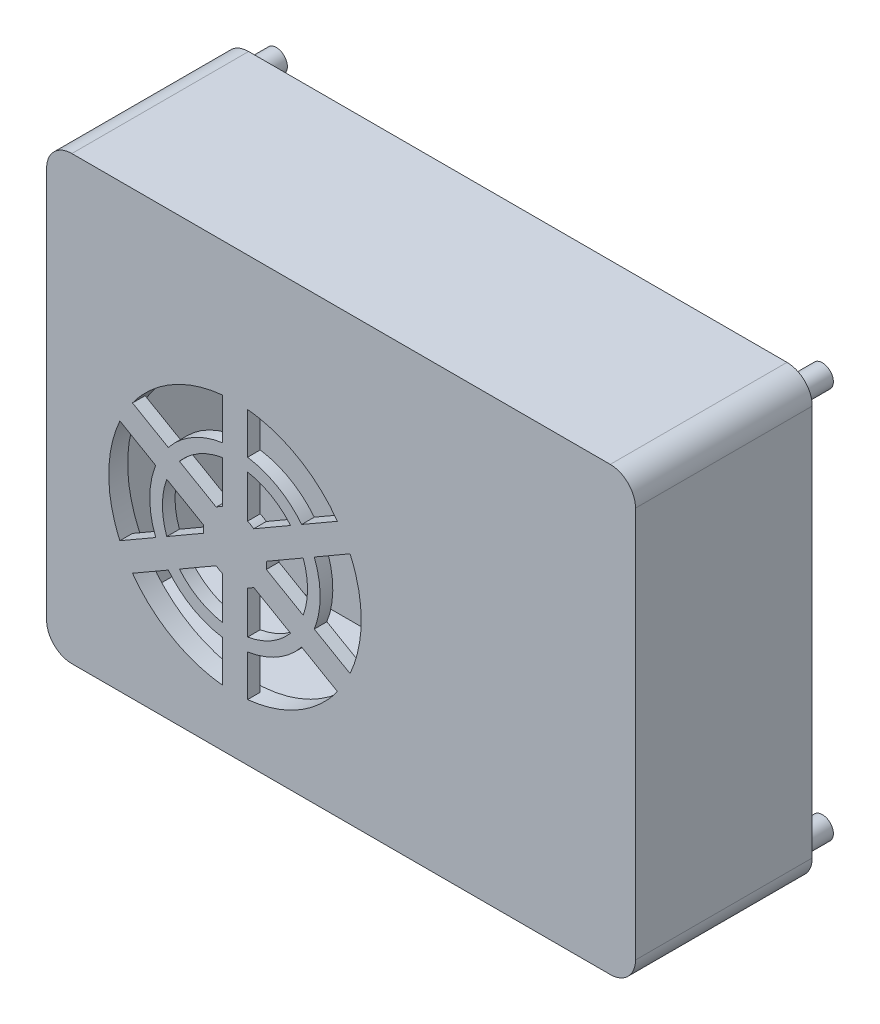
from build123d import *

# Parameters (mm, degrees)
BOSS_EXTRUDE1_DEPTH     = 28
SKETCH2_R               = 1.75
BOSS_EXTRUDE4_DEPTH     = 5
CUT_EXTRUDE_START       = 5
SKETCH_2_W              = 83.3
SKETCH_2_H              = 60
CUT_EXTRUDE_1_DEPTH     = 20
MACRO_START             = 25
MACRO_FEATURE_1_DEPTH   = 3
MACRO_FEATURE_1_2_DEPTH = 1


# Read off the part's stored shape, not the designer's step: 通风口1
with BuildPart() as part:
    # Sketch1 → Boss-Extrude1 (new body)
    with BuildSketch(Plane.XY):
        with BuildLine():
            Line((-42.65, -35), (42.65, -35))
            ThreePointArc((42.65, -35), (45.478427125, -33.828427125), (46.65, -31))
            Line((46.65, -31), (46.65, 31))
            ThreePointArc((46.65, 31), (45.478427125, 33.828427125), (42.65, 35))
            Line((42.65, 35), (-42.65, 35))
            ThreePointArc((-42.65, 35), (-45.478427125, 33.828427125), (-46.65, 31))
            Line((-46.65, 31), (-46.65, -31))
            ThreePointArc((-46.65, -31), (-45.478427125, -33.828427125), (-42.65, -35))
        make_face()
    extrude(amount=BOSS_EXTRUDE1_DEPTH)

    # Sketch2 → Boss-Extrude4 (add)
    with BuildSketch(Plane.XY):
        with Locations((-43.25, -31)):
            Circle(SKETCH2_R)
        with Locations((-43.25, 31)):
            Circle(SKETCH2_R)
        with Locations((43.25, -31)):
            Circle(SKETCH2_R)
        with Locations((43.25, 31)):
            Circle(SKETCH2_R)
    extrude(amount=-BOSS_EXTRUDE4_DEPTH)

    # 草图2 → 切除-拉伸1 (cut)
    with BuildSketch(Plane.XY.offset(CUT_EXTRUDE_START)):
        Rectangle(SKETCH_2_W, SKETCH_2_H)
    extrude(amount=CUT_EXTRUDE_1_DEPTH, mode=Mode.SUBTRACT)

    # Macro Feature 1 outline → Macro Feature 1 (cut)
    with BuildSketch(Plane.XY.offset(MACRO_START)):
        with BuildLine():
            add(Edge.make_bspline(
                [(1.426287217, -14.318481279), (1.51048252, -14.131697761), (2.111375863, -12.741996864), (2.934772067, -10.027623346), (3.321543695, -6.100665106), (2.934772067, -2.173706865), (2.111375766, 0.540666973), (1.510482256, 1.93036816), (1.426286806, 2.117151978)],
                knots=[0.932608761, 0.932608761, 0.932608761, 0.932608761, 0.9375, 0.96875, 1, 1.03125, 1.0625, 1.067391247, 1.067391247, 1.067391247, 1.067391247], degree=3))
            Line((1.426286806, 2.117151978), (-4.245054535, -1.157202769))
            add(Edge.make_bspline(
                [(-4.245054936, -11.044128462), (-3.950864394, -10.29643753), (-3.473540164, -8.671281329), (-3.307380181, -6.98423071), (-3.307380181, -6.100665106), (-3.307380181, -5.217099501), (-3.473540128, -3.530049248), (-3.950864187, -1.904893384), (-4.245054535, -1.157202769)],
                knots=[0.940332295, 0.940332295, 0.940332295, 0.940332295, 0.96875, 1, 1, 1, 1.03125, 1.059667692, 1.059667692, 1.059667692, 1.059667692], degree=3))
            Line((-4.245054936, -11.044128462), (1.426287217, -14.318481279))
        make_face()
        with BuildLine():
            Line((-6.245083648, 2.306863228), (-0.573711847, 5.581242019))
            add(Edge.make_bspline(
                [(-0.573711847, 5.581242019), (-1.203151971, 6.455827928), (-2.753859768, 8.280173587), (-5.624349253, 10.635923426), (-9.104374502, 12.496035675), (-12.238304555, 13.446702963), (-14.169380367, 13.734885584), (-14.807380181, 13.799005145)],
                knots=[0.099275483, 0.099275483, 0.099275483, 0.099275483, 0.125, 0.15625, 0.1875, 0.21875, 0.2340578, 0.2340578, 0.2340578, 0.2340578], degree=3))
            Line((-14.807380181, 13.799005145), (-14.807389315, 7.250337375))
            add(Edge.make_bspline(
                [(-6.245083648, 2.306863228), (-6.562071208, 2.705072273), (-7.49087461, 3.745605129), (-9.258834304, 5.196532153), (-11.607851348, 6.452107921), (-13.513275888, 7.030112136), (-14.595308244, 7.218580527), (-14.807389315, 7.250337375)],
                knots=[0.106998881, 0.106998881, 0.106998881, 0.106998881, 0.125, 0.15625, 0.1875, 0.21875, 0.226334474, 0.226334474, 0.226334474, 0.226334474], degree=3))
        make_face()
        with BuildLine():
            add(Edge.make_bspline(
                [(-14.807380181, -26.000335357), (-14.169380367, -25.936215795), (-12.238304555, -25.648033174), (-9.104374502, -24.697365886), (-5.624349253, -22.837253637), (-2.753860037, -20.481504018), (-1.20315242, -18.657158668), (-0.573712453, -17.782573072)],
                knots=[0.7659422, 0.7659422, 0.7659422, 0.7659422, 0.78125, 0.8125, 0.84375, 0.875, 0.900724509, 0.900724509, 0.900724509, 0.900724509], degree=3))
            Line((-0.573712453, -17.782573072), (-6.245084026, -14.508193914))
            add(Edge.make_bspline(
                [(-14.807387794, -19.451667358), (-14.595307234, -19.419910563), (-13.513275395, -19.231442198), (-11.607851348, -18.653438132), (-9.258834304, -17.397862364), (-7.490874767, -15.946935469), (-6.562071478, -14.906402786), (-6.245084026, -14.508193914)],
                knots=[0.773665544, 0.773665544, 0.773665544, 0.773665544, 0.78125, 0.8125, 0.84375, 0.875, 0.893001112, 0.893001112, 0.893001112, 0.893001112], degree=3))
            Line((-14.807387794, -19.451667358), (-14.807380181, -26.000335357))
        make_face()
        with BuildLine():
            Line((-18.807372568, 7.250337147), (-18.807380181, 13.799005145))
            add(Edge.make_bspline(
                [(-18.807380181, 13.799005145), (-19.445379995, 13.734885584), (-21.376455807, 13.446702963), (-24.510385859, 12.496035675), (-27.990411109, 10.635923426), (-30.860900325, 8.280173807), (-32.411607941, 6.455828457), (-33.041047909, 5.581242861)],
                knots=[0.2659422, 0.2659422, 0.2659422, 0.2659422, 0.28125, 0.3125, 0.34375, 0.375, 0.400724509, 0.400724509, 0.400724509, 0.400724509], degree=3))
            Line((-33.041047909, 5.581242861), (-27.369676336, 2.306863702))
            add(Edge.make_bspline(
                [(-18.807372568, 7.250337147), (-19.019453128, 7.218580351), (-20.101484966, 7.030111987), (-22.006909014, 6.452107921), (-24.355926057, 5.196532153), (-26.123885595, 3.745605258), (-27.052688884, 2.705072575), (-27.369676336, 2.306863702)],
                knots=[0.273665544, 0.273665544, 0.273665544, 0.273665544, 0.28125, 0.3125, 0.34375, 0.375, 0.393001112, 0.393001112, 0.393001112, 0.393001112], degree=3))
        make_face()
        with BuildLine():
            add(Edge.make_bspline(
                [(-33.041048515, -17.78257223), (-32.411608391, -18.657158139), (-30.860900594, -20.481503798), (-27.990411109, -22.837253637), (-24.510385859, -24.697365886), (-21.376455807, -25.648033174), (-19.445379995, -25.936215795), (-18.807380181, -26.000335357)],
                knots=[0.599275483, 0.599275483, 0.599275483, 0.599275483, 0.625, 0.65625, 0.6875, 0.71875, 0.7340578, 0.7340578, 0.7340578, 0.7340578], degree=3))
            Line((-18.807380181, -26.000335357), (-18.807371047, -19.451667586))
            add(Edge.make_bspline(
                [(-27.369676714, -14.508193439), (-27.052689154, -14.906402484), (-26.123885752, -15.94693534), (-24.355926057, -17.397862364), (-22.006909014, -18.653438132), (-20.101484473, -19.231442348), (-19.019452118, -19.419910739), (-18.807371047, -19.451667586)],
                knots=[0.606998881, 0.606998881, 0.606998881, 0.606998881, 0.625, 0.65625, 0.6875, 0.71875, 0.726334474, 0.726334474, 0.726334474, 0.726334474], degree=3))
            Line((-27.369676714, -14.508193439), (-33.041048515, -17.78257223))
        make_face()
        with BuildLine():
            Line((-29.36970625, -1.157203845), (-35.041047578, 2.117151068))
            add(Edge.make_bspline(
                [(-35.041047578, 2.117151068), (-35.125242882, 1.930367549), (-35.726136224, 0.540666652), (-36.549532429, -2.173706865), (-36.936304057, -6.100665106), (-36.549532429, -10.027623346), (-35.726136127, -12.741997184), (-35.125242618, -14.131698372), (-35.041047168, -14.318482189)],
                knots=[0.432608761, 0.432608761, 0.432608761, 0.432608761, 0.4375, 0.46875, 0.5, 0.53125, 0.5625, 0.567391247, 0.567391247, 0.567391247, 0.567391247], degree=3))
            Line((-35.041047168, -14.318482189), (-29.369705827, -11.044127442))
            add(Edge.make_bspline(
                [(-29.36970625, -1.157203845), (-29.663896392, -1.904894127), (-30.141220272, -3.530049633), (-30.394403797, -6.100665106), (-30.141220234, -8.671280964), (-29.663896174, -10.296436827), (-29.369705827, -11.044127442)],
                knots=[0.440332322, 0.440332322, 0.440332322, 0.440332322, 0.46875, 0.5, 0.53125, 0.559667692, 0.559667692, 0.559667692, 0.559667692], degree=3))
        make_face()
        with BuildLine():
            Line((-19.776002799, -10.123994238), (-25.614874012, -13.49505794))
            add(Edge.make_bspline(
                [(-25.614874012, -13.49505794), (-25.4004441, -13.750475645), (-24.66593116, -14.552021269), (-23.237622965, -15.724203511), (-21.236608446, -16.793768054), (-19.709698943, -17.256950988), (-18.888721178, -17.411048691), (-18.807380181, -17.425409802)],
                knots=[0.611153802, 0.611153802, 0.611153802, 0.611153802, 0.625, 0.65625, 0.6875, 0.71875, 0.722179425, 0.722179425, 0.722179425, 0.722179425], degree=3))
            Line((-18.807380181, -17.425409802), (-18.807380181, -10.683238244))
            add(Edge.make_bspline(
                [(-19.776002799, -10.123994238), (-19.713465965, -10.170143035), (-19.407680931, -10.384972589), (-19.07855675, -10.56487264), (-18.807380181, -10.683238244)],
                knots=[0.648828167, 0.648828167, 0.648828167, 0.648828167, 0.65625, 0.684505004, 0.684505004, 0.684505004, 0.684505004], degree=3))
        make_face()
        with BuildLine():
            Line((-21.775987505, -5.5414213), (-27.61488085, -2.170343066))
            add(Edge.make_bspline(
                [(-27.61488085, -2.170343066), (-27.814569737, -2.719547072), (-28.17569281, -4.010953791), (-28.38151141, -6.100665106), (-28.17569287, -8.190375807), (-27.814570068, -9.481781955), (-27.614881479, -10.030985416)],
                knots=[0.444487223, 0.444487223, 0.444487223, 0.444487223, 0.46875, 0.5, 0.53125, 0.555512751, 0.555512751, 0.555512751, 0.555512751], degree=3))
            Line((-27.614881479, -10.030985416), (-21.775987689, -6.659907275))
            add(Edge.make_bspline(
                [(-21.775987505, -5.5414213), (-21.796877556, -5.727056153), (-21.817882775, -6.100664557), (-21.796877618, -6.47427296), (-21.775987689, -6.659907275)],
                knots=[0.482161339, 0.482161339, 0.482161339, 0.482161339, 0.5, 0.517838609, 0.517838609, 0.517838609, 0.517838609], degree=3))
        make_face()
        with BuildLine():
            Line((-11.838773138, -6.659911406), (-5.999879511, -10.030987145))
            add(Edge.make_bspline(
                [(-5.999879511, -10.030987145), (-5.800190625, -9.48178314), (-5.439067552, -8.19037642), (-5.307380181, -6.853332102), (-5.307380181, -6.100665106), (-5.307380181, -5.347998109), (-5.439067492, -4.010954405), (-5.800190293, -2.719548257), (-5.999878882, -2.170344796)],
                knots=[0.944487223, 0.944487223, 0.944487223, 0.944487223, 0.96875, 1, 1, 1, 1.03125, 1.055512751, 1.055512751, 1.055512751, 1.055512751], degree=3))
            Line((-5.999878882, -2.170344796), (-11.838772395, -5.541425409))
            add(Edge.make_bspline(
                [(-11.838773138, -6.659911406), (-11.8178829, -6.474275731), (-11.807380181, -6.287470418), (-11.807380181, -6.100665106), (-11.807380181, -5.913862008), (-11.817882651, -5.72705891), (-11.838772395, -5.541425409)],
                knots=[0.982161259, 0.982161259, 0.982161259, 0.982161259, 1, 1, 1, 1.01783853, 1.01783853, 1.01783853, 1.01783853], degree=3))
        make_face()
        with BuildLine():
            Line((-13.838757562, -2.077335974), (-7.99988635, 1.293727729))
            add(Edge.make_bspline(
                [(-7.99988635, 1.293727729), (-8.214316262, 1.549145435), (-8.948829202, 2.350691058), (-10.377137397, 3.5228733), (-12.378151916, 4.592437843), (-13.905061419, 5.055620777), (-14.726039183, 5.209718479), (-14.807380181, 5.224079591)],
                knots=[0.111153802, 0.111153802, 0.111153802, 0.111153802, 0.125, 0.15625, 0.1875, 0.21875, 0.222179425, 0.222179425, 0.222179425, 0.222179425], degree=3))
            Line((-14.807380181, 5.224079591), (-14.807380181, -1.518091967))
            add(Edge.make_bspline(
                [(-13.838757562, -2.077335974), (-13.901294396, -2.031187177), (-14.20707943, -1.816357623), (-14.536203611, -1.636457571), (-14.807380181, -1.518091967)],
                knots=[0.148828167, 0.148828167, 0.148828167, 0.148828167, 0.15625, 0.184505004, 0.184505004, 0.184505004, 0.184505004], degree=3))
        make_face()
        with BuildLine():
            Line((-18.807380177, -1.518091965), (-18.807380181, 5.224079591))
            add(Edge.make_bspline(
                [(-18.807380181, 5.224079591), (-18.888721178, 5.209718479), (-19.709698943, 5.055620777), (-21.236608446, 4.592437843), (-23.237622965, 3.5228733), (-24.665931302, 2.35069094), (-25.400444349, 1.549145163), (-25.614874367, 1.293727306)],
                knots=[0.277820575, 0.277820575, 0.277820575, 0.277820575, 0.28125, 0.3125, 0.34375, 0.375, 0.388846205, 0.388846205, 0.388846205, 0.388846205], degree=3))
            Line((-25.614874367, 1.293727306), (-19.776006434, -2.077338655))
            add(Edge.make_bspline(
                [(-18.807380177, -1.518091965), (-19.078556748, -1.63645757), (-19.407682257, -1.816358347), (-19.71346843, -2.031188908), (-19.776006434, -2.077338655)],
                knots=[0.315494996, 0.315494996, 0.315494996, 0.315494996, 0.34375, 0.351171977, 0.351171977, 0.351171977, 0.351171977], degree=3))
        make_face()
        with BuildLine():
            Line((-14.807380184, -10.683238246), (-14.807380181, -17.425409802))
            add(Edge.make_bspline(
                [(-14.807380181, -17.425409802), (-14.726039183, -17.411048691), (-13.905061419, -17.256950988), (-12.378151916, -16.793768054), (-10.377137397, -15.724203511), (-8.948829061, -14.552021153), (-8.214316016, -13.750475378), (-7.999886, -13.495057523)],
                knots=[0.777820575, 0.777820575, 0.777820575, 0.777820575, 0.78125, 0.8125, 0.84375, 0.875, 0.888846205, 0.888846205, 0.888846205, 0.888846205], degree=3))
            Line((-7.999886, -13.495057523), (-13.838753934, -10.123991561))
            add(Edge.make_bspline(
                [(-14.807380184, -10.683238246), (-14.536203614, -10.564872641), (-14.207078107, -10.384971866), (-13.901291936, -10.170141306), (-13.838753934, -10.123991561)],
                knots=[0.815494996, 0.815494996, 0.815494996, 0.815494996, 0.84375, 0.851171977, 0.851171977, 0.851171977, 0.851171977], degree=3))
        make_face()
    extrude(amount=MACRO_FEATURE_1_DEPTH, mode=Mode.SUBTRACT)

    # Macro Feature 1 2 outline → Macro Feature 1 2 (cut)
    with BuildSketch(Plane.XY.offset(MACRO_START)):
        with BuildLine():
            Line((-4.245054535, -1.157202769), (1.426286806, 2.117151978))
            add(Edge.make_bspline(
                [(1.426286806, 2.117151978), (0.972560625, 3.1237231), (0.322820334, 4.295836045), (-0.43851161, 5.393385831), (-0.573711847, 5.581242019)],
                knots=[0.067391247, 0.067391247, 0.067391247, 0.067391247, 0.09375, 0.099275483, 0.099275483, 0.099275483, 0.099275483], degree=3))
            Line((-0.573711847, 5.581242019), (-6.245083648, 2.306863228))
            add(Edge.make_bspline(
                [(-6.245083648, 2.306863228), (-6.562071208, 2.705072273), (-7.49087461, 3.745605129), (-9.258834304, 5.196532153), (-11.607851348, 6.452107921), (-13.513275888, 7.030112136), (-14.595308244, 7.218580527), (-14.807389315, 7.250337375)],
                knots=[0.106998881, 0.106998881, 0.106998881, 0.106998881, 0.125, 0.15625, 0.1875, 0.21875, 0.226334474, 0.226334474, 0.226334474, 0.226334474], degree=3))
            Line((-14.807389315, 7.250337375), (-14.807380181, 13.799005145))
            add(Edge.make_bspline(
                [(-14.807380181, 13.799005145), (-15.471820605, 13.865782012), (-16.807380181, 13.932887777), (-18.142939757, 13.865782012), (-18.807380181, 13.799005145)],
                knots=[0.2340578, 0.2340578, 0.2340578, 0.2340578, 0.25, 0.2659422, 0.2659422, 0.2659422, 0.2659422], degree=3))
            Line((-18.807380181, 13.799005145), (-18.807372568, 7.250337147))
            add(Edge.make_bspline(
                [(-18.807372568, 7.250337147), (-19.019453128, 7.218580351), (-20.101484966, 7.030111987), (-22.006909014, 6.452107921), (-24.355926057, 5.196532153), (-26.123885595, 3.745605258), (-27.052688884, 2.705072575), (-27.369676336, 2.306863702)],
                knots=[0.273665544, 0.273665544, 0.273665544, 0.273665544, 0.28125, 0.3125, 0.34375, 0.375, 0.393001112, 0.393001112, 0.393001112, 0.393001112], degree=3))
            Line((-27.369676336, 2.306863702), (-33.041047909, 5.581242861))
            add(Edge.make_bspline(
                [(-33.041047909, 5.581242861), (-33.176248357, 5.3933864), (-33.937580718, 4.295836075), (-34.587321311, 3.123722515), (-35.041047578, 2.117151068)],
                knots=[0.400724509, 0.400724509, 0.400724509, 0.400724509, 0.40625, 0.432608761, 0.432608761, 0.432608761, 0.432608761], degree=3))
            Line((-35.041047578, 2.117151068), (-29.36970625, -1.157203845))
            add(Edge.make_bspline(
                [(-29.36970625, -1.157203845), (-29.663896392, -1.904894127), (-30.141220272, -3.530049633), (-30.394403797, -6.100665106), (-30.141220234, -8.671280964), (-29.663896174, -10.296436827), (-29.369705827, -11.044127442)],
                knots=[0.440332322, 0.440332322, 0.440332322, 0.440332322, 0.46875, 0.5, 0.53125, 0.559667692, 0.559667692, 0.559667692, 0.559667692], degree=3))
            Line((-29.369705827, -11.044127442), (-35.041047168, -14.318482189))
            add(Edge.make_bspline(
                [(-35.041047168, -14.318482189), (-34.587320987, -15.325053311), (-33.937580696, -16.497166256), (-33.176248752, -17.594716042), (-33.041048515, -17.78257223)],
                knots=[0.567391247, 0.567391247, 0.567391247, 0.567391247, 0.59375, 0.599275483, 0.599275483, 0.599275483, 0.599275483], degree=3))
            Line((-33.041048515, -17.78257223), (-27.369676714, -14.508193439))
            add(Edge.make_bspline(
                [(-27.369676714, -14.508193439), (-27.052689154, -14.906402484), (-26.123885752, -15.94693534), (-24.355926057, -17.397862364), (-22.006909014, -18.653438132), (-20.101484473, -19.231442348), (-19.019452118, -19.419910739), (-18.807371047, -19.451667586)],
                knots=[0.606998881, 0.606998881, 0.606998881, 0.606998881, 0.625, 0.65625, 0.6875, 0.71875, 0.726334474, 0.726334474, 0.726334474, 0.726334474], degree=3))
            Line((-18.807371047, -19.451667586), (-18.807380181, -26.000335357))
            add(Edge.make_bspline(
                [(-18.807380181, -26.000335357), (-18.142939757, -26.067112223), (-16.807380181, -26.134217988), (-15.471820605, -26.067112223), (-14.807380181, -26.000335357)],
                knots=[0.7340578, 0.7340578, 0.7340578, 0.7340578, 0.75, 0.7659422, 0.7659422, 0.7659422, 0.7659422], degree=3))
            Line((-14.807380181, -26.000335357), (-14.807387794, -19.451667358))
            add(Edge.make_bspline(
                [(-14.807387794, -19.451667358), (-14.595307234, -19.419910563), (-13.513275395, -19.231442198), (-11.607851348, -18.653438132), (-9.258834304, -17.397862364), (-7.490874767, -15.946935469), (-6.562071478, -14.906402786), (-6.245084026, -14.508193914)],
                knots=[0.773665544, 0.773665544, 0.773665544, 0.773665544, 0.78125, 0.8125, 0.84375, 0.875, 0.893001112, 0.893001112, 0.893001112, 0.893001112], degree=3))
            Line((-6.245084026, -14.508193914), (-0.573712453, -17.782573072))
            add(Edge.make_bspline(
                [(-0.573712453, -17.782573072), (-0.438512004, -17.594716611), (0.322820356, -16.497166286), (0.972560949, -15.325052727), (1.426287217, -14.318481279)],
                knots=[0.900724509, 0.900724509, 0.900724509, 0.900724509, 0.90625, 0.932608761, 0.932608761, 0.932608761, 0.932608761], degree=3))
            Line((1.426287217, -14.318481279), (-4.245054936, -11.044128462))
            add(Edge.make_bspline(
                [(-4.245054936, -11.044128462), (-3.950864394, -10.29643753), (-3.473540164, -8.671281329), (-3.307380181, -6.98423071), (-3.307380181, -6.100665106), (-3.307380181, -5.217099501), (-3.473540128, -3.530049248), (-3.950864187, -1.904893384), (-4.245054535, -1.157202769)],
                knots=[0.940332295, 0.940332295, 0.940332295, 0.940332295, 0.96875, 1, 1, 1, 1.03125, 1.059667692, 1.059667692, 1.059667692, 1.059667692], degree=3))
        make_face()
        with BuildLine():
            add(Edge.make_bspline(
                [(-25.614874012, -13.49505794), (-25.4004441, -13.750475645), (-24.66593116, -14.552021269), (-23.237622965, -15.724203511), (-21.236608446, -16.793768054), (-19.709698943, -17.256950988), (-18.888721178, -17.411048691), (-18.807380181, -17.425409802)],
                knots=[0.611153802, 0.611153802, 0.611153802, 0.611153802, 0.625, 0.65625, 0.6875, 0.71875, 0.722179425, 0.722179425, 0.722179425, 0.722179425], degree=3))
            Line((-25.614874012, -13.49505794), (-19.776002799, -10.123994238))
            add(Edge.make_bspline(
                [(-19.776002799, -10.123994238), (-19.713465965, -10.170143035), (-19.407680931, -10.384972589), (-19.07855675, -10.56487264), (-18.807380181, -10.683238244)],
                knots=[0.648828167, 0.648828167, 0.648828167, 0.648828167, 0.65625, 0.684505004, 0.684505004, 0.684505004, 0.684505004], degree=3))
            Line((-18.807380181, -10.683238244), (-18.807380181, -17.425409802))
        make_face(mode=Mode.SUBTRACT)
        with BuildLine():
            add(Edge.make_bspline(
                [(-14.807380181, -17.425409802), (-14.726039183, -17.411048691), (-13.905061419, -17.256950988), (-12.378151916, -16.793768054), (-10.377137397, -15.724203511), (-8.948829061, -14.552021153), (-8.214316016, -13.750475378), (-7.999886, -13.495057523)],
                knots=[0.777820575, 0.777820575, 0.777820575, 0.777820575, 0.78125, 0.8125, 0.84375, 0.875, 0.888846205, 0.888846205, 0.888846205, 0.888846205], degree=3))
            Line((-14.807380181, -17.425409802), (-14.807380184, -10.683238246))
            add(Edge.make_bspline(
                [(-14.807380184, -10.683238246), (-14.536203614, -10.564872641), (-14.207078107, -10.384971866), (-13.901291936, -10.170141306), (-13.838753934, -10.123991561)],
                knots=[0.815494996, 0.815494996, 0.815494996, 0.815494996, 0.84375, 0.851171977, 0.851171977, 0.851171977, 0.851171977], degree=3))
            Line((-13.838753934, -10.123991561), (-7.999886, -13.495057523))
        make_face(mode=Mode.SUBTRACT)
        with BuildLine():
            add(Edge.make_bspline(
                [(-5.999879511, -10.030987145), (-5.800190625, -9.48178314), (-5.439067552, -8.19037642), (-5.307380181, -6.853332102), (-5.307380181, -6.100665106), (-5.307380181, -5.347998109), (-5.439067492, -4.010954405), (-5.800190293, -2.719548257), (-5.999878882, -2.170344796)],
                knots=[0.944487223, 0.944487223, 0.944487223, 0.944487223, 0.96875, 1, 1, 1, 1.03125, 1.055512751, 1.055512751, 1.055512751, 1.055512751], degree=3))
            Line((-5.999879511, -10.030987145), (-11.838773138, -6.659911406))
            add(Edge.make_bspline(
                [(-11.838773138, -6.659911406), (-11.8178829, -6.474275731), (-11.807380181, -6.287470418), (-11.807380181, -6.100665106), (-11.807380181, -5.913862008), (-11.817882651, -5.72705891), (-11.838772395, -5.541425409)],
                knots=[0.982161259, 0.982161259, 0.982161259, 0.982161259, 1, 1, 1, 1.01783853, 1.01783853, 1.01783853, 1.01783853], degree=3))
            Line((-11.838772395, -5.541425409), (-5.999878882, -2.170344796))
        make_face(mode=Mode.SUBTRACT)
        with BuildLine():
            add(Edge.make_bspline(
                [(-27.61488085, -2.170343066), (-27.814569737, -2.719547072), (-28.17569281, -4.010953791), (-28.38151141, -6.100665106), (-28.17569287, -8.190375807), (-27.814570068, -9.481781955), (-27.614881479, -10.030985416)],
                knots=[0.444487223, 0.444487223, 0.444487223, 0.444487223, 0.46875, 0.5, 0.53125, 0.555512751, 0.555512751, 0.555512751, 0.555512751], degree=3))
            Line((-27.61488085, -2.170343066), (-21.775987505, -5.5414213))
            add(Edge.make_bspline(
                [(-21.775987505, -5.5414213), (-21.796877556, -5.727056153), (-21.817882775, -6.100664557), (-21.796877618, -6.47427296), (-21.775987689, -6.659907275)],
                knots=[0.482161339, 0.482161339, 0.482161339, 0.482161339, 0.5, 0.517838609, 0.517838609, 0.517838609, 0.517838609], degree=3))
            Line((-21.775987689, -6.659907275), (-27.614881479, -10.030985416))
        make_face(mode=Mode.SUBTRACT)
        with BuildLine():
            add(Edge.make_bspline(
                [(-18.807380181, 5.224079591), (-18.888721178, 5.209718479), (-19.709698943, 5.055620777), (-21.236608446, 4.592437843), (-23.237622965, 3.5228733), (-24.665931302, 2.35069094), (-25.400444349, 1.549145163), (-25.614874367, 1.293727306)],
                knots=[0.277820575, 0.277820575, 0.277820575, 0.277820575, 0.28125, 0.3125, 0.34375, 0.375, 0.388846205, 0.388846205, 0.388846205, 0.388846205], degree=3))
            Line((-18.807380181, 5.224079591), (-18.807380177, -1.518091965))
            add(Edge.make_bspline(
                [(-18.807380177, -1.518091965), (-19.078556748, -1.63645757), (-19.407682257, -1.816358347), (-19.71346843, -2.031188908), (-19.776006434, -2.077338655)],
                knots=[0.315494996, 0.315494996, 0.315494996, 0.315494996, 0.34375, 0.351171977, 0.351171977, 0.351171977, 0.351171977], degree=3))
            Line((-19.776006434, -2.077338655), (-25.614874367, 1.293727306))
        make_face(mode=Mode.SUBTRACT)
        with BuildLine():
            add(Edge.make_bspline(
                [(-7.99988635, 1.293727729), (-8.214316262, 1.549145435), (-8.948829202, 2.350691058), (-10.377137397, 3.5228733), (-12.378151916, 4.592437843), (-13.905061419, 5.055620777), (-14.726039183, 5.209718479), (-14.807380181, 5.224079591)],
                knots=[0.111153802, 0.111153802, 0.111153802, 0.111153802, 0.125, 0.15625, 0.1875, 0.21875, 0.222179425, 0.222179425, 0.222179425, 0.222179425], degree=3))
            Line((-7.99988635, 1.293727729), (-13.838757562, -2.077335974))
            add(Edge.make_bspline(
                [(-13.838757562, -2.077335974), (-13.901294396, -2.031187177), (-14.20707943, -1.816357623), (-14.536203611, -1.636457571), (-14.807380181, -1.518091967)],
                knots=[0.148828167, 0.148828167, 0.148828167, 0.148828167, 0.15625, 0.184505004, 0.184505004, 0.184505004, 0.184505004], degree=3))
            Line((-14.807380181, -1.518091967), (-14.807380181, 5.224079591))
        make_face(mode=Mode.SUBTRACT)
    extrude(amount=MACRO_FEATURE_1_2_DEPTH, mode=Mode.SUBTRACT)


solid = part.part
